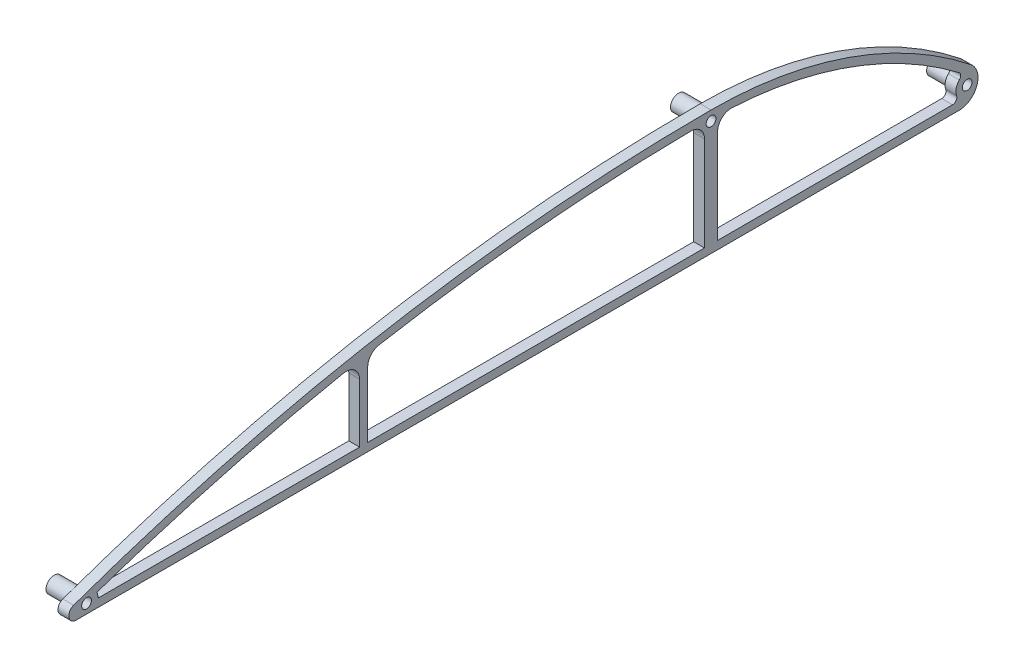
from build123d import *
from build123d.topology import SkipClean

# Parameters (mm, degrees)
BOSS_EXTRU_1_DEPTH      = 2
ESQUISSE4_R             = 0.9
ENL_V_MAT_EXTRU_2_DEPTH = 176.894862906
ENL_V_MAT_EXTRU_3_DEPTH = 4
CONG_2_R                = 1.35
CONG_3_R                = 2.5
CONG_4_R                = 0.8
BOSS_EXTRU_2_DEPTH      = 6


with BuildPart() as part:
    # Esquisse2 → Boss.-Extru.1 (new body)
    with BuildSketch(Plane(origin=(0, 0, 0), x_dir=(0, 0, -1), z_dir=(1, 0, 0))):
        with BuildLine():
            Line((0, 0), (170.873171093, 0))
            ThreePointArc((170.873171093, 0), (174.177922559, 2.347343181), (173.049882129, 6.240789861))
            ThreePointArc((173.049882129, 6.240789861), (150.444362328, 18.689979585), (125, 23))
            ThreePointArc((125, 23), (61.450806457, 17.202138822), (0, 0))
        make_face()
    extrude(amount=BOSS_EXTRU_1_DEPTH)

    # Esquisse4 → Enlèv. mat.-Extru.2 (cut, through all)
    with BuildSketch(Plane(origin=(2, 0, 0), x_dir=(0, 0, -1), z_dir=(1, 0, 0))):
        with Locations((125, 21.2)):
            Circle(ESQUISSE4_R)
        with Locations((172.368958832, 3.328337296)):
            Circle(ESQUISSE4_R)
        with Locations((9.5, 1.731368161)):
            Circle(ESQUISSE4_R)
    extrude(amount=-ENL_V_MAT_EXTRU_2_DEPTH, mode=Mode.SUBTRACT)

    # Esquisse9 → Enlèv. mat.-Extru.3 (cut)
    with BuildSketch(Plane(origin=(0, 0, 0), x_dir=(0, 0, -1), z_dir=(1, 0, 0))):
        with BuildLine():
            Line((126.213985158, 1.5), (171.335913464, 1.5))
            ThreePointArc((171.335913464, 1.5), (170.282716542, 3.568322942), (171.778038927, 5.343483362))
            ThreePointArc((171.778038927, 5.343483362), (150.318961844, 17.152112342), (126.213985158, 21.497892659))
            Line((126.213985158, 21.497892659), (126.213985158, 1.5))
        make_face()
        with BuildLine():
            Line((11.587215555, 1.5), (60, 1.5))
            Line((60, 1.5), (60, 15.405547145))
            ThreePointArc((60, 15.405547145), (35.486713367, 9.848596531), (11.435943567, 2.545077264))
            ThreePointArc((11.435943567, 2.545077264), (11.578340432, 2.03220208), (11.587215555, 1.5))
        make_face()
        with BuildLine():
            Line((61.5, 1.5), (123.786014842, 1.5))
            Line((123.786014842, 1.5), (123.786014842, 21.497892659))
            ThreePointArc((123.786014842, 21.497892659), (92.512776663, 19.987580782), (61.5, 15.685935533))
            Line((61.5, 15.685935533), (61.5, 1.5))
        make_face()
    extrude(amount=ENL_V_MAT_EXTRU_3_DEPTH, mode=Mode.SUBTRACT)

    # Congé2
    cong_2_edges = [part.edges().sort_by_distance(p)[0] for p in [
        (1, 0, 0),
    ]]
    fillet(cong_2_edges, radius=CONG_2_R)

    # Congé3
    cong_3_edges = [part.edges().sort_by_distance(p)[0] for p in [
        (1, 21.497892659, -126.213985158),
        (1, 21.497892659, -123.786014842),
        (1, 15.405547145, -60),
        (1, 15.685935533, -61.5),
    ]]
    fillet(cong_3_edges, radius=CONG_3_R)

    # Congé4
    cong_4_edges = [part.edges().sort_by_distance(p)[0] for p in [
        (1, 1.5, -171.335913464),
        (1, 5.343483362, -171.778038927),
    ]]
    fillet(cong_4_edges, radius=CONG_4_R)

    # Esquisse12 → Boss.-Extru.2 (add)
    with SkipClean():  # the faces are left unmerged after this step: merging them gives an invalid solid
        with BuildSketch(Plane(origin=(2, 0, 0), x_dir=(0, 0, -1), z_dir=(1, 0, 0))):
            with BuildLine():
                Line((123.776111778, 20.33276438), (124.265667067, 20.679658628))
                ThreePointArc((124.265667067, 20.679658628), (124.994957368, 22.099985873), (125.740117603, 20.687919992))
                Line((125.740117603, 20.687919992), (126.233529338, 20.34653332))
                ThreePointArc((126.233529338, 20.34653332), (124.991595614, 22.699976455), (123.776111778, 20.33276438))
            make_face()
            with BuildLine():
                Line((8.271271934, 0.871003506), (8.76276316, 1.215149368))
                ThreePointArc((8.76276316, 1.215149368), (9.5, 2.631368161), (10.23723684, 1.215149368))
                Line((10.23723684, 1.215149368), (10.728728066, 0.871003506))
                ThreePointArc((10.728728066, 0.871003506), (9.5, 3.231368161), (8.271271934, 0.871003506))
            make_face()
            with BuildLine():
                Line((171.140230765, 2.467972642), (171.631721992, 2.812118504))
                ThreePointArc((171.631721992, 2.812118504), (172.368958832, 4.228337296), (173.106195671, 2.812118504))
                Line((173.106195671, 2.812118504), (173.597686898, 2.467972642))
                ThreePointArc((173.597686898, 2.467972642), (172.368958832, 4.828337296), (171.140230765, 2.467972642))
            make_face()
        extrude(amount=-BOSS_EXTRU_2_DEPTH)


solid = part.part
